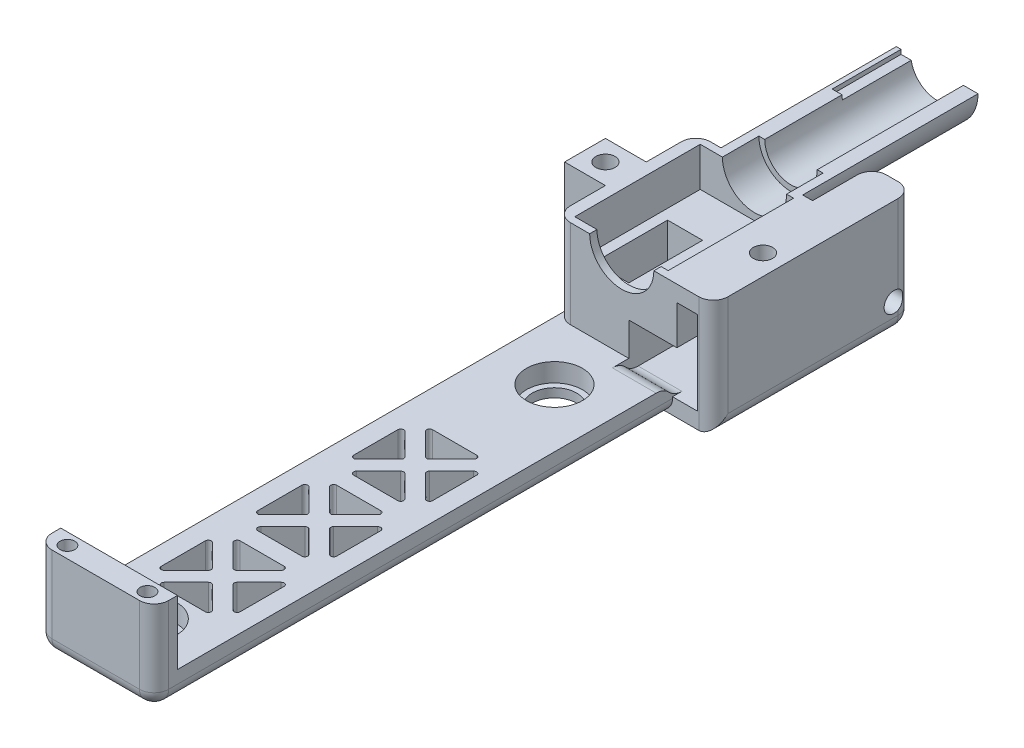
from build123d import *

# Parameters (mm, degrees)
SKETCH1_W                = 20
SKETCH1_H                = 112.840000126
BOSS_EXTRUDE1_DEPTH      = 4.68927065
SKETCH2_W                = 20
SKETCH2_H                = 4
BOSS_EXTRUDE2_DEPTH      = 10.99057492
SKETCH19_W               = 20
SKETCH19_H               = 24
BOSS_EXTRUDE6_DEPTH      = 15.15438009
SKETCH20_W               = 16
SKETCH20_H               = 21.5
CUT_EXTRUDE17_DEPTH      = 6.7
CUT_EXTRUDE18_REACH      = 117.007
SKETCH21_R               = 5.5
SKETCH22_W               = 7
SKETCH22_H               = 34.16
BOSS_EXTRUDE7_DEPTH      = 19.84365074
BOSS_EXTRUDE8_DEPTH      = 7
CUT_EXTRUDE19_REACH      = 73.726
SKETCH24_R               = 1.65
CUT_EXTRUDE2_DEPTH       = 73.262519007
CUT_EXTRUDE2_DEPTH_BACK  = 73.262519007
SKETCH5_W                = 6
SKETCH5_H                = 12.65
BOSS_EXTRUDE9_START      = 5
BOSS_EXTRUDE9_DEPTH      = 5
BOSS_EXTRUDE10_START     = 25.05
BOSS_EXTRUDE10_DEPTH     = 25.05
SKETCH27_W               = 1.75
SKETCH27_H               = 0.75
CUT_EXTRUDE20_DEPTH      = 11.8
SKETCH28_R               = 1.65
CUT_EXTRUDE21_DEPTH      = 93.248096983
M3_CLEARANCE_HOLE1_D     = 3.4
M3_CLEARANCE_HOLE1_DEPTH = 17.02
M3_CLEARANCE_HOLE1_TIP   = 1.021463052
SKETCH6_R                = 4.8006
CUT_EXTRUDE3_DEPTH       = 3.175
SKETCH7_R                = 3.81
CUT_EXTRUDE4_DEPTH       = 0.508
SKETCH8_R                = 4.8006
SKETCH8_R_2              = 3.302
CUT_EXTRUDE5_DEPTH       = 3.175
CUT_EXTRUDE6_REACH       = 93.934
SKETCH10_R               = 3.81
SHELL1_START             = 2.75
SHELL1_DEPTH             = 7.64365074
SHELL1_START_2           = 9.29365074
SHELL1_2_DEPTH           = 7.8
SHELL1_3_DEPTH           = 6.54365074
SHELL1_START_3           = 12.75
SHELL1_4_DEPTH           = 1.5
SKETCH13_R               = 1.2635
CUT_EXTRUDE11_DEPTH      = 10
CUT_EXTRUDE16_REACH      = 94.248
FILLET11_R               = 2.5
FILLET12_R               = 3
FILLET13_R               = 3


with BuildPart() as part:
    # Sketch1 → Boss-Extrude1 (new body)
    with BuildSketch(Plane(origin=(0, 0, 0), x_dir=(1, 0, 0), z_dir=(0, 1, 0))):
        with Locations((0, 2.000000063)):
            Rectangle(SKETCH1_W, SKETCH1_H)
    extrude(amount=BOSS_EXTRUDE1_DEPTH)

    # Sketch2 → Boss-Extrude2 (add)
    with BuildSketch(Plane(origin=(0, 4.68927065, 0), x_dir=(1, 0, 0), z_dir=(0, 1, 0))):
        with Locations((0, -52.42)):
            Rectangle(SKETCH2_W, SKETCH2_H)
    extrude(amount=BOSS_EXTRUDE2_DEPTH)

    # Sketch19 → Boss-Extrude6 (add)
    with BuildSketch(Plane(origin=(0, 4.68927065, 0), x_dir=(1, 0, 0), z_dir=(0, 1, 0))):
        with Locations((0, 46.420000126)):
            Rectangle(SKETCH19_W, SKETCH19_H)
    extrude(amount=BOSS_EXTRUDE6_DEPTH)

    # Sketch20 → Cut-Extrude17 (cut)
    with BuildSketch(Plane(origin=(0, 19.84365074, 0), x_dir=(1, 0, 0), z_dir=(0, 1, 0))):
        with Locations((0, 46.420000126)):
            Rectangle(SKETCH20_W, SKETCH20_H)
    extrude(amount=-CUT_EXTRUDE17_DEPTH, mode=Mode.SUBTRACT)

    # Cut-Extrude18: up to this face of the body (flat: up to its plane)
    cut_extrude18_end = Plane(part.part.faces().sort_by_distance((0, 12.266460695, -34.420000126))[0])
    # Sketch21 → Cut-Extrude18 (cut, up to the picked face)
    with BuildSketch(Plane(origin=(0, 0, -58.420000126), x_dir=(-1, 0, 0), z_dir=(0, 0, -1)), mode=Mode.PRIVATE) as cut_extrude18_sk1:
        with Locations((-1.3, 19.84365074)):
            Circle(SKETCH21_R)
    cut_extrude18_tool1 = split(extrude(cut_extrude18_sk1.sketch, amount=-CUT_EXTRUDE18_REACH, mode=Mode.PRIVATE), bisect_by=cut_extrude18_end, keep=Keep.BOTH, mode=Mode.PRIVATE)
    add(cut_extrude18_tool1.solids().sort_by(Axis((1.3, 19.843651, -58.42), (0, 0, 1)))[0], mode=Mode.SUBTRACT)

    # Sketch22 → Boss-Extrude7 (add)
    with BuildSketch(Plane(origin=(0, 19.84365074, 0), x_dir=(1, 0, 0), z_dir=(0, 1, 0))):
        with Locations((13.5, 51.500000126)):
            Rectangle(SKETCH22_W, SKETCH22_H)
    extrude(amount=-BOSS_EXTRUDE7_DEPTH)

    # Sketch23 → Boss-Extrude8 (add)
    with BuildSketch(Plane.ZY.offset(10)):
        Polygon((-42.920000126, 19.84365074), (-46.420000126, 19.84365074), (-49.920000126, 19.84365074), (-49.920000126, 12.34365074), (-42.920000126, 12.34365074), align=None)
    extrude(amount=BOSS_EXTRUDE8_DEPTH)

    # Sketch24 → Cut-Extrude19 (cut, up to next)
    with BuildSketch(Plane.XZ.offset(-12.34365074), mode=Mode.PRIVATE) as cut_extrude19_sk1:
        with Locations(Location((-13.5, -46.420000126, 0), (0, 0, 270))):
            Circle(SKETCH24_R)
    cut_extrude19_tool1 = extrude(cut_extrude19_sk1.sketch, amount=-CUT_EXTRUDE19_REACH, mode=Mode.PRIVATE) & part.part
    add(cut_extrude19_tool1.solids().sort_by_distance((-13.5, 12.343651, -46.42))[0], mode=Mode.SUBTRACT)

    # Sketch5 → Cut-Extrude2 (cut, two sides: drawn at the far end of the back side and taken through both)
    with BuildSketch(Plane(origin=(0, 4.68927065, 0), x_dir=(1, 0, 0), z_dir=(0, 1, 0)).offset(-CUT_EXTRUDE2_DEPTH_BACK)):
        with Locations((-3.25, 43.495000126)):
            Rectangle(SKETCH5_W, SKETCH5_H)
    extrude(amount=CUT_EXTRUDE2_DEPTH + CUT_EXTRUDE2_DEPTH_BACK, mode=Mode.SUBTRACT)

    # Sketch25 → Boss-Extrude9 (add)
    with BuildSketch(Plane(origin=(0, 0, -58.420000126), x_dir=(-1, 0, 0), z_dir=(0, 0, -1)).offset(BOSS_EXTRUDE9_START)):
        with BuildLine():
            Line((5.7, 19.84365074), (4.2, 19.84365074))
            ThreePointArc((4.2, 19.84365074), (-1.3, 14.34365074), (-6.8, 19.84365074))
            Line((-6.8, 19.84365074), (-8.3, 19.84365074))
            ThreePointArc((-8.3, 19.84365074), (-1.3, 12.84365074), (5.7, 19.84365074))
        make_face()
    extrude(amount=-BOSS_EXTRUDE9_DEPTH)

    # Sketch26 → Boss-Extrude10 (add)
    with BuildSketch(Plane(origin=(0, 0, -63.420000126), x_dir=(-1, 0, 0), z_dir=(0, 0, -1)).offset(BOSS_EXTRUDE10_START)):
        with BuildLine():
            Line((5.7, 19.84365074), (3.2, 19.84365074))
            ThreePointArc((3.2, 19.84365074), (-1.3, 15.34365074), (-5.8, 19.84365074))
            Line((-5.8, 19.84365074), (-8.3, 19.84365074))
            ThreePointArc((-8.3, 19.84365074), (-1.3, 12.84365074), (5.7, 19.84365074))
        make_face()
    extrude(amount=-BOSS_EXTRUDE10_DEPTH)

    # Sketch27 → Cut-Extrude20 (cut)
    with BuildSketch(Plane(origin=(0, 0, -88.470000126), x_dir=(-1, 0, 0), z_dir=(0, 0, -1))):
        with Locations((4.01205984, 19.46865074)):
            Rectangle(SKETCH27_W, SKETCH27_H)
    extrude(amount=-CUT_EXTRUDE20_DEPTH, mode=Mode.SUBTRACT)

    # Sketch28 → Cut-Extrude21 (cut, through all)
    with BuildSketch(Plane(origin=(0, 19.84365074, 0), x_dir=(1, 0, 0), z_dir=(0, 1, 0))):
        with Locations(Location((13.5, 46.420000126, 0), (0, 0, 270))):
            Circle(SKETCH28_R)
    extrude(amount=-CUT_EXTRUDE21_DEPTH, mode=Mode.SUBTRACT)

    # M3 Clearance Hole1
    with Locations(Plane(origin=(17, 0, 0), x_dir=(0, 0, -1), z_dir=(1, 0, 0))):
        with Locations((65.380000126, 4.84365074)):
            Hole(M3_CLEARANCE_HOLE1_D / 2, depth=M3_CLEARANCE_HOLE1_DEPTH)
            with Locations((0, 0, -(M3_CLEARANCE_HOLE1_DEPTH + M3_CLEARANCE_HOLE1_TIP / 2))):  # 118° drill point
                Cone(0, M3_CLEARANCE_HOLE1_D / 2, M3_CLEARANCE_HOLE1_TIP, mode=Mode.SUBTRACT)

    # Sketch6 → Cut-Extrude3 (cut)
    with BuildSketch(Plane(origin=(0, 4.68927065, 0), x_dir=(1, 0, 0), z_dir=(0, 1, 0))):
        with Locations(Location((0, -45.34, 0), (0, 0, 270))):
            Circle(SKETCH6_R)
    extrude(amount=-CUT_EXTRUDE3_DEPTH, mode=Mode.SUBTRACT)

    # Sketch7 → Cut-Extrude4 (cut)
    with BuildSketch(Plane(origin=(0, 1.51427065, 0), x_dir=(1, 0, 0), z_dir=(0, 1, 0))):
        with Locations(Location((0, -45.34, 0), (0, 0, 270))):
            Circle(SKETCH7_R)
    extrude(amount=-CUT_EXTRUDE4_DEPTH, mode=Mode.SUBTRACT)

    # Sketch8 → Cut-Extrude5 (cut)
    with BuildSketch(Plane(origin=(0, 4.68927065, 0), x_dir=(1, 0, 0), z_dir=(0, 1, 0))):
        with Locations(Location((0, 24.18399989, 0), (0, 0, 270))):
            Circle(SKETCH8_R)
        with Locations((0, -45.34)):
            Circle(SKETCH8_R_2)
    extrude(amount=-CUT_EXTRUDE5_DEPTH, mode=Mode.SUBTRACT)

    # Sketch10 → Cut-Extrude6 (cut, up to next)
    with BuildSketch(Plane(origin=(0, 1.51427065, 0), x_dir=(1, 0, 0), z_dir=(0, 1, 0)), mode=Mode.PRIVATE) as cut_extrude6_sk1:
        with Locations(Location((0, 24.18399989, 0), (0, 0, 270))):
            Circle(SKETCH10_R)
    cut_extrude6_tool1 = extrude(cut_extrude6_sk1.sketch, amount=-CUT_EXTRUDE6_REACH, mode=Mode.PRIVATE) & part.part
    add(cut_extrude6_tool1.solids().sort_by_distance((0, 1.514271, -24.184))[0], mode=Mode.SUBTRACT)

    # Shell1: read off the stored shape, not the designer's step
    # Shell1 outline → Shell1 (cut)
    with BuildSketch(Plane(origin=(0, 0, 0), x_dir=(1, 0, 0), z_dir=(0, 1, 0)).offset(SHELL1_START)):
        with BuildLine():
            Line((2.5, 34.420000126), (14.25, 34.420000126))
            Line((14.25, 34.420000126), (14.25, 42.084391749))
            ThreePointArc((14.25, 42.084391749), (9.488190801, 44.612961955), (10.75, 49.854749025))
            Line((10.75, 49.854749025), (10.75, 55.670000126))
            Line((10.75, 55.670000126), (-7.25, 55.670000126))
            Line((-7.25, 55.670000126), (-7.25, 52.570000126))
            Line((-7.25, 52.570000126), (2.5, 52.570000126))
            Line((2.5, 52.570000126), (2.5, 34.420000126))
        make_face()
    extrude(amount=SHELL1_DEPTH, mode=Mode.SUBTRACT)

    # Shell1 2 outline → Shell1 2 (cut)
    with BuildSketch(Plane(origin=(0, 0, 0), x_dir=(1, 0, 0), z_dir=(0, 1, 0)).offset(SHELL1_START_2)):
        with BuildLine():
            Line((10.75, 42.985251227), (10.75, 34.420000126))
            Line((10.75, 34.420000126), (14.25, 34.420000126))
            Line((14.25, 34.420000126), (14.25, 42.084391749))
            ThreePointArc((14.25, 42.084391749), (12.40323797, 42.158883717), (10.75, 42.985251227))
        make_face()
        with BuildLine():
            Line((10.75, 55.670000126), (10.75, 49.854749025))
            ThreePointArc((10.75, 49.854749025), (12.40323797, 50.681116535), (14.25, 50.755608503))
            Line((14.25, 50.755608503), (14.25, 65.830000126))
            Line((14.25, 65.830000126), (12.75, 65.830000126))
            Line((12.75, 65.830000126), (12.75, 55.670000126))
            Line((12.75, 55.670000126), (10.75, 55.670000126))
        make_face()
    extrude(amount=SHELL1_2_DEPTH, mode=Mode.SUBTRACT)

    # Shell1 3 outline → Shell1 3 (cut)
    with BuildSketch(Plane(origin=(0, 0, 0), x_dir=(1, 0, 0), z_dir=(0, 1, 0)).offset(SHELL1_START)):
        with BuildLine():
            ThreePointArc((10.75, 49.854749025), (12.40323797, 50.681116535), (14.25, 50.755608503))
            Line((14.25, 50.755608503), (14.25, 65.830000126))
            Line((14.25, 65.830000126), (12.75, 65.830000126))
            Line((12.75, 65.830000126), (12.75, 55.670000126))
            Line((12.75, 55.670000126), (10.75, 55.670000126))
            Line((10.75, 55.670000126), (10.75, 49.854749025))
        make_face()
    extrude(amount=SHELL1_3_DEPTH, mode=Mode.SUBTRACT)

    # Shell1 4 outline → Shell1 4 (add)
    with BuildSketch(Plane.YZ.offset(SHELL1_START_3)):
        with BuildLine():
            ThreePointArc((3.204291109, -65.830000126), (4.84365074, -63.680000126), (6.483010371, -65.830000126))
            Line((6.483010371, -65.830000126), (9.270839464, -65.830000126))
            ThreePointArc((9.270839464, -65.830000126), (7.323624213, -61.685107493), (2.75, -61.453280556))
            Line((2.75, -61.453280556), (2.75, -65.830000126))
            Line((2.75, -65.830000126), (3.204291109, -65.830000126))
        make_face()
    extrude(amount=SHELL1_4_DEPTH)

    # Sketch13 → Cut-Extrude11 (cut)
    with BuildSketch(Plane(origin=(0, 15.67984557, 0), x_dir=(1, 0, 0), z_dir=(0, 1, 0))):
        with Locations(Location((-6.858, -52.42, 0), (0, 0, 270))):
            Circle(SKETCH13_R)
        with Locations(Location((6.858, -52.42, 0), (0, 0, 270))):
            Circle(SKETCH13_R)
    extrude(amount=-CUT_EXTRUDE11_DEPTH, mode=Mode.SUBTRACT)

    # Sketch18 → Cut-Extrude16 (cut, up to next)
    with BuildSketch(Plane(origin=(0, 0, 0), x_dir=(-1, 0, 0), z_dir=(0, -1, 0)), mode=Mode.PRIVATE) as cut_extrude16_sk1:
        with BuildLine():
            Line((2.073075498, -0.084547272), (5.846655008, -3.858126783))
            ThreePointArc((5.846655008, -3.858126783), (6.400268437, -3.96824734), (6.713865253, -3.498916538))
            Line((6.713865253, -3.498916538), (6.713865253, 4.048242483))
            ThreePointArc((6.713865253, 4.048242483), (6.400268437, 4.517573285), (5.846655008, 4.407452728))
            Line((5.846655008, 4.407452728), (2.073075498, 0.633873217))
            ThreePointArc((2.073075498, 0.633873217), (1.924285743, 0.274662973), (2.073075498, -0.084547272))
        make_face()
    cut_extrude16_tool1 = extrude(cut_extrude16_sk1.sketch, amount=-CUT_EXTRUDE16_REACH, mode=Mode.PRIVATE) & part.part
    # Sketch18 → Cut-Extrude16 (cut, up to next)
    with BuildSketch(Plane(origin=(0, 0, 0), x_dir=(-1, 0, 0), z_dir=(0, -1, 0)), mode=Mode.PRIVATE) as cut_extrude16_sk2:
        with BuildLine():
            Line((0.3154759, 2.391472815), (4.08905541, 6.165052326))
            ThreePointArc((4.08905541, 6.165052326), (4.199175968, 6.718665754), (3.729845166, 7.032262571))
            Line((3.729845166, 7.032262571), (-3.817313855, 7.032262571))
            ThreePointArc((-3.817313855, 7.032262571), (-4.286644658, 6.718665754), (-4.1765241, 6.165052326))
            Line((-4.1765241, 6.165052326), (-0.40294459, 2.391472815))
            ThreePointArc((-0.40294459, 2.391472815), (-0.043734345, 2.24268306), (0.3154759, 2.391472815))
        make_face()
    cut_extrude16_tool2 = extrude(cut_extrude16_sk2.sketch, amount=-CUT_EXTRUDE16_REACH, mode=Mode.PRIVATE) & part.part
    # Sketch18 → Cut-Extrude16 (cut, up to next)
    with BuildSketch(Plane(origin=(0, 0, 0), x_dir=(-1, 0, 0), z_dir=(0, -1, 0)), mode=Mode.PRIVATE) as cut_extrude16_sk3:
        with BuildLine():
            Line((-0.40294459, -1.84214687), (-4.1765241, -5.615726381))
            ThreePointArc((-4.1765241, -5.615726381), (-4.286644658, -6.169339809), (-3.817313855, -6.482936625))
            Line((-3.817313855, -6.482936625), (3.729845166, -6.482936625))
            ThreePointArc((3.729845166, -6.482936625), (4.199175968, -6.169339809), (4.08905541, -5.615726381))
            Line((4.08905541, -5.615726381), (0.3154759, -1.84214687))
            ThreePointArc((0.3154759, -1.84214687), (-0.043734345, -1.693357115), (-0.40294459, -1.84214687))
        make_face()
    cut_extrude16_tool3 = extrude(cut_extrude16_sk3.sketch, amount=-CUT_EXTRUDE16_REACH, mode=Mode.PRIVATE) & part.part
    # Sketch18 → Cut-Extrude16 (cut, up to next)
    with BuildSketch(Plane(origin=(0, 0, 0), x_dir=(-1, 0, 0), z_dir=(0, -1, 0)), mode=Mode.PRIVATE) as cut_extrude16_sk4:
        with BuildLine():
            Line((-2.160544188, 0.633873217), (-5.934123698, 4.407452728))
            ThreePointArc((-5.934123698, 4.407452728), (-6.487737126, 4.517573285), (-6.801333943, 4.048242483))
            Line((-6.801333943, 4.048242483), (-6.801333943, -3.498916538))
            ThreePointArc((-6.801333943, -3.498916538), (-6.487737126, -3.96824734), (-5.934123698, -3.858126783))
            Line((-5.934123698, -3.858126783), (-2.160544188, -0.084547272))
            ThreePointArc((-2.160544188, -0.084547272), (-2.011754432, 0.274662973), (-2.160544188, 0.633873217))
        make_face()
    cut_extrude16_tool4 = extrude(cut_extrude16_sk4.sketch, amount=-CUT_EXTRUDE16_REACH, mode=Mode.PRIVATE) & part.part
    # Sketch18 → Cut-Extrude16 (cut, up to next)
    with BuildSketch(Plane(origin=(0, 0, 0), x_dir=(-1, 0, 0), z_dir=(0, -1, 0)), mode=Mode.PRIVATE) as cut_extrude16_sk5:
        with BuildLine():
            Line((2.055146486, -16.542228087), (5.828725996, -20.315807597))
            ThreePointArc((5.828725996, -20.315807597), (6.382339424, -20.425928155), (6.695936241, -19.956597353))
            Line((6.695936241, -19.956597353), (6.695936241, -12.409438332))
            ThreePointArc((6.695936241, -12.409438332), (6.382339424, -11.940107529), (5.828725996, -12.050228087))
            Line((5.828725996, -12.050228087), (2.055146486, -15.823807597))
            ThreePointArc((2.055146486, -15.823807597), (1.90635673, -16.183017842), (2.055146486, -16.542228087))
        make_face()
    cut_extrude16_tool5 = extrude(cut_extrude16_sk5.sketch, amount=-CUT_EXTRUDE16_REACH, mode=Mode.PRIVATE) & part.part
    # Sketch18 → Cut-Extrude16 (cut, up to next)
    with BuildSketch(Plane(origin=(0, 0, 0), x_dir=(-1, 0, 0), z_dir=(0, -1, 0)), mode=Mode.PRIVATE) as cut_extrude16_sk6:
        with BuildLine():
            Line((0.297546888, -14.066207999), (4.071126398, -10.292628489))
            ThreePointArc((4.071126398, -10.292628489), (4.181246956, -9.739015061), (3.711916153, -9.425418244))
            Line((3.711916153, -9.425418244), (-3.835242868, -9.425418244))
            ThreePointArc((-3.835242868, -9.425418244), (-4.30457367, -9.739015061), (-4.194453112, -10.292628489))
            Line((-4.194453112, -10.292628489), (-0.420873602, -14.066207999))
            ThreePointArc((-0.420873602, -14.066207999), (-0.061663357, -14.214997755), (0.297546888, -14.066207999))
        make_face()
    cut_extrude16_tool6 = extrude(cut_extrude16_sk6.sketch, amount=-CUT_EXTRUDE16_REACH, mode=Mode.PRIVATE) & part.part
    # Sketch18 → Cut-Extrude16 (cut, up to next)
    with BuildSketch(Plane(origin=(0, 0, 0), x_dir=(-1, 0, 0), z_dir=(0, -1, 0)), mode=Mode.PRIVATE) as cut_extrude16_sk7:
        with BuildLine():
            Line((-0.420873602, -18.299827685), (-4.194453112, -22.073407195))
            ThreePointArc((-4.194453112, -22.073407195), (-4.30457367, -22.627020624), (-3.835242868, -22.94061744))
            Line((-3.835242868, -22.94061744), (3.711916153, -22.94061744))
            ThreePointArc((3.711916153, -22.94061744), (4.181246956, -22.627020624), (4.071126398, -22.073407195))
            Line((4.071126398, -22.073407195), (0.297546888, -18.299827685))
            ThreePointArc((0.297546888, -18.299827685), (-0.061663357, -18.15103793), (-0.420873602, -18.299827685))
        make_face()
    cut_extrude16_tool7 = extrude(cut_extrude16_sk7.sketch, amount=-CUT_EXTRUDE16_REACH, mode=Mode.PRIVATE) & part.part
    # Sketch18 → Cut-Extrude16 (cut, up to next)
    with BuildSketch(Plane(origin=(0, 0, 0), x_dir=(-1, 0, 0), z_dir=(0, -1, 0)), mode=Mode.PRIVATE) as cut_extrude16_sk8:
        with BuildLine():
            Line((-2.1784732, -15.823807597), (-5.95205271, -12.050228087))
            ThreePointArc((-5.95205271, -12.050228087), (-6.505666139, -11.940107529), (-6.819262955, -12.409438332))
            Line((-6.819262955, -12.409438332), (-6.819262955, -19.956597353))
            ThreePointArc((-6.819262955, -19.956597353), (-6.505666139, -20.425928155), (-5.95205271, -20.315807597))
            Line((-5.95205271, -20.315807597), (-2.1784732, -16.542228087))
            ThreePointArc((-2.1784732, -16.542228087), (-2.029683445, -16.183017842), (-2.1784732, -15.823807597))
        make_face()
    cut_extrude16_tool8 = extrude(cut_extrude16_sk8.sketch, amount=-CUT_EXTRUDE16_REACH, mode=Mode.PRIVATE) & part.part
    # Sketch18 → Cut-Extrude16 (cut, up to next)
    with BuildSketch(Plane(origin=(0, 0, 0), x_dir=(-1, 0, 0), z_dir=(0, -1, 0)), mode=Mode.PRIVATE) as cut_extrude16_sk9:
        with BuildLine():
            Line((2.070039222, -33.073628806), (5.843618732, -36.847208316))
            ThreePointArc((5.843618732, -36.847208316), (6.397232161, -36.957328874), (6.710828977, -36.487998071))
            Line((6.710828977, -36.487998071), (6.710828977, -28.94083905))
            ThreePointArc((6.710828977, -28.94083905), (6.397232161, -28.471508248), (5.843618732, -28.581628806))
            Line((5.843618732, -28.581628806), (2.070039222, -32.355208316))
            ThreePointArc((2.070039222, -32.355208316), (1.921249467, -32.714418561), (2.070039222, -33.073628806))
        make_face()
    cut_extrude16_tool9 = extrude(cut_extrude16_sk9.sketch, amount=-CUT_EXTRUDE16_REACH, mode=Mode.PRIVATE) & part.part
    # Sketch18 → Cut-Extrude16 (cut, up to next)
    with BuildSketch(Plane(origin=(0, 0, 0), x_dir=(-1, 0, 0), z_dir=(0, -1, 0)), mode=Mode.PRIVATE) as cut_extrude16_sk10:
        with BuildLine():
            Line((0.312439624, -30.597608718), (4.086019134, -26.824029208))
            ThreePointArc((4.086019134, -26.824029208), (4.196139692, -26.270415779), (3.726808889, -25.956818963))
            Line((3.726808889, -25.956818963), (-3.820350131, -25.956818963))
            ThreePointArc((-3.820350131, -25.956818963), (-4.289680934, -26.270415779), (-4.179560376, -26.824029208))
            Line((-4.179560376, -26.824029208), (-0.405980866, -30.597608718))
            ThreePointArc((-0.405980866, -30.597608718), (-0.046770621, -30.746398473), (0.312439624, -30.597608718))
        make_face()
    cut_extrude16_tool10 = extrude(cut_extrude16_sk10.sketch, amount=-CUT_EXTRUDE16_REACH, mode=Mode.PRIVATE) & part.part
    # Sketch18 → Cut-Extrude16 (cut, up to next)
    with BuildSketch(Plane(origin=(0, 0, 0), x_dir=(-1, 0, 0), z_dir=(0, -1, 0)), mode=Mode.PRIVATE) as cut_extrude16_sk11:
        with BuildLine():
            Line((-0.405980866, -34.831228404), (-4.179560376, -38.604807914))
            ThreePointArc((-4.179560376, -38.604807914), (-4.289680934, -39.158421342), (-3.820350131, -39.472018159))
            Line((-3.820350131, -39.472018159), (3.726808889, -39.472018159))
            ThreePointArc((3.726808889, -39.472018159), (4.196139692, -39.158421342), (4.086019134, -38.604807914))
            Line((4.086019134, -38.604807914), (0.312439624, -34.831228404))
            ThreePointArc((0.312439624, -34.831228404), (-0.046770621, -34.682438648), (-0.405980866, -34.831228404))
        make_face()
    cut_extrude16_tool11 = extrude(cut_extrude16_sk11.sketch, amount=-CUT_EXTRUDE16_REACH, mode=Mode.PRIVATE) & part.part
    # Sketch18 → Cut-Extrude16 (cut, up to next)
    with BuildSketch(Plane(origin=(0, 0, 0), x_dir=(-1, 0, 0), z_dir=(0, -1, 0)), mode=Mode.PRIVATE) as cut_extrude16_sk12:
        with BuildLine():
            Line((-2.163580464, -32.355208316), (-5.937159974, -28.581628806))
            ThreePointArc((-5.937159974, -28.581628806), (-6.490773403, -28.471508248), (-6.804370219, -28.94083905))
            Line((-6.804370219, -28.94083905), (-6.804370219, -36.487998071))
            ThreePointArc((-6.804370219, -36.487998071), (-6.490773403, -36.957328874), (-5.937159974, -36.847208316))
            Line((-5.937159974, -36.847208316), (-2.163580464, -33.073628806))
            ThreePointArc((-2.163580464, -33.073628806), (-2.014790709, -32.714418561), (-2.163580464, -32.355208316))
        make_face()
    cut_extrude16_tool12 = extrude(cut_extrude16_sk12.sketch, amount=-CUT_EXTRUDE16_REACH, mode=Mode.PRIVATE) & part.part
    add(cut_extrude16_tool1.solids().sort_by_distance((-5.016606, 0, -0.274663))[0], mode=Mode.SUBTRACT)
    add(cut_extrude16_tool2.solids().sort_by_distance((0.043734, 0, -5.335003))[0], mode=Mode.SUBTRACT)
    add(cut_extrude16_tool3.solids().sort_by_distance((0.043734, 0, 4.785677))[0], mode=Mode.SUBTRACT)
    add(cut_extrude16_tool4.solids().sort_by_distance((5.104075, 0, -0.274663))[0], mode=Mode.SUBTRACT)
    add(cut_extrude16_tool5.solids().sort_by_distance((-4.998677, 0, 16.183018))[0], mode=Mode.SUBTRACT)
    add(cut_extrude16_tool6.solids().sort_by_distance((0.061663, 0, 11.122678))[0], mode=Mode.SUBTRACT)
    add(cut_extrude16_tool7.solids().sort_by_distance((0.061663, 0, 21.243358))[0], mode=Mode.SUBTRACT)
    add(cut_extrude16_tool8.solids().sort_by_distance((5.122004, 0, 16.183018))[0], mode=Mode.SUBTRACT)
    add(cut_extrude16_tool9.solids().sort_by_distance((-5.01357, 0, 32.714419))[0], mode=Mode.SUBTRACT)
    add(cut_extrude16_tool10.solids().sort_by_distance((0.046771, 0, 27.654078))[0], mode=Mode.SUBTRACT)
    add(cut_extrude16_tool11.solids().sort_by_distance((0.046771, 0, 37.774759))[0], mode=Mode.SUBTRACT)
    add(cut_extrude16_tool12.solids().sort_by_distance((5.107111, 0, 32.714419))[0], mode=Mode.SUBTRACT)

    # Fillet11
    # the kernel refuses this fillet: 2.5 mm, written as the material it takes off along each edge
    with BuildSketch(Plane(origin=(-7.5, 2.5, 51.92), x_dir=(-1, 0, 0), z_dir=(0, 0, 1))) as fillet11_piece_1_section:
        Polygon((0, 0), (FILLET11_R * 1.02, 0), (FILLET11_R * 1.02, FILLET11_R * 1.02), (0, FILLET11_R * 1.02), align=None)
    fillet11_piece_1 = extrude(amount=FILLET11_R * 1.02, mode=Mode.PRIVATE)
    fillet11_piece_1 = fillet11_piece_1 - Plane(origin=(-7.5, 2.5, 51.92), x_dir=(0.7071067811865475, 0.7071067811865475, 0), z_dir=(0, 0, 1)) * Sphere(FILLET11_R, mode=Mode.PRIVATE)
    add(fillet11_piece_1, mode=Mode.SUBTRACT)
    with BuildSketch(Plane(origin=(7.5, 2.5, 51.92), x_dir=(1, 0, 0), z_dir=(0, 0, 1))) as fillet11_piece_2_section:
        Polygon((0, 0), (FILLET11_R * 1.02, 0), (FILLET11_R * 1.02, -FILLET11_R * 1.02), (0, -FILLET11_R * 1.02), align=None)
    fillet11_piece_2 = extrude(amount=FILLET11_R * 1.02, mode=Mode.PRIVATE)
    fillet11_piece_2 = fillet11_piece_2 - Plane(origin=(7.5, 2.5, 51.92), x_dir=(-0.7071067811865475, 0.7071067811865475, 0), z_dir=(0, 0, 1)) * Sphere(FILLET11_R, mode=Mode.PRIVATE)
    add(fillet11_piece_2, mode=Mode.SUBTRACT)
    with BuildSketch(Plane(origin=(12.5, 2.5, -66.080000126), x_dir=(0, 0, -1), z_dir=(-1, 0, 0))) as fillet11_piece_3_section:
        Polygon((0, 0), (FILLET11_R * 1.02, 0), (FILLET11_R * 1.02, FILLET11_R * 1.02), (0, FILLET11_R * 1.02), align=None)
    fillet11_piece_3 = extrude(amount=FILLET11_R * 1.02, mode=Mode.PRIVATE)
    fillet11_piece_3 = fillet11_piece_3 - Plane(origin=(12.5, 2.5, -66.080000126), x_dir=(0, 0.7071067811865475, 0.7071067811865475), z_dir=(-1, 0, 0)) * Sphere(FILLET11_R, mode=Mode.PRIVATE)
    add(fillet11_piece_3, mode=Mode.SUBTRACT)
    with BuildSketch(Plane(origin=(14.5, 2.5, -66.080000126), x_dir=(0, 0, -1), z_dir=(1, 0, 0))) as fillet11_piece_4_section:
        Polygon((0, 0), (FILLET11_R * 1.02, 0), (FILLET11_R * 1.02, -FILLET11_R * 1.02), (0, -FILLET11_R * 1.02), align=None)
    fillet11_piece_4 = extrude(amount=FILLET11_R * 1.02, mode=Mode.PRIVATE)
    fillet11_piece_4 = fillet11_piece_4 - Plane(origin=(14.5, 2.5, -66.080000126), x_dir=(0, 0.7071067811865475, 0.7071067811865475), z_dir=(1, 0, 0)) * Sphere(FILLET11_R, mode=Mode.PRIVATE)
    add(fillet11_piece_4, mode=Mode.SUBTRACT)
    with BuildSketch(Plane(origin=(-7.5, 2.5, -55.920000126), x_dir=(0, -1, 0), z_dir=(-1, 0, 0))) as fillet11_piece_5_section:
        Polygon((0, 0), (FILLET11_R * 1.02, 0), (FILLET11_R * 1.02, -FILLET11_R * 1.02), (0, -FILLET11_R * 1.02), align=None)
    fillet11_piece_5 = extrude(amount=FILLET11_R * 1.02, mode=Mode.PRIVATE)
    fillet11_piece_5 = fillet11_piece_5 - Plane(origin=(-7.5, 2.5, -55.920000126), x_dir=(0, 0.7071067811865475, 0.7071067811865475), z_dir=(-1, 0, 0)) * Sphere(FILLET11_R, mode=Mode.PRIVATE)
    add(fillet11_piece_5, mode=Mode.SUBTRACT)
    with BuildSketch(Plane(origin=(-7.5, 0, 54.42), x_dir=(0, 1, 0), z_dir=(1, 0, 0))) as fillet11_piece_6:
        with BuildLine():
            CenterArc((FILLET11_R, -FILLET11_R), FILLET11_R, 90, 90)
            Line((0, -FILLET11_R), (0, 0))
            Line((0, 0), (FILLET11_R, 0))
        make_face()
    extrude(amount=15, mode=Mode.SUBTRACT)
    with BuildSketch(Plane(origin=(10, 2.5, 54.42), x_dir=(-1, 0, 0), z_dir=(0, 1, 0)), Plane(origin=(-10, 21.92984557, 54.42), x_dir=(1, 0, 0), z_dir=(0, -1, 0))) as fillet11_piece_7:
        with BuildLine():
            CenterArc((FILLET11_R, -FILLET11_R), FILLET11_R, 90, 90)
            Line((0, -FILLET11_R), (0, 0))
            Line((0, 0), (FILLET11_R, 0))
        make_face()
    extrude(amount=19.42984557, mode=Mode.SUBTRACT)
    with BuildSketch(Plane(origin=(-10, 4.68927065, -34.420000126), x_dir=(0, 0, -1), z_dir=(0, 1, 0))) as fillet11_piece_8:
        with BuildLine():
            CenterArc((FILLET11_R, -FILLET11_R), FILLET11_R, 90, 90)
            Line((0, -FILLET11_R), (0, 0))
            Line((0, 0), (FILLET11_R, 0))
        make_face()
    extrude(amount=21.40438009, mode=Mode.SUBTRACT)
    with BuildSketch(Plane(origin=(10, 26.09365074, -68.580000126), x_dir=(0, 0, 1), z_dir=(0, -1, 0)), Plane(origin=(-10, 26.09365074, -58.420000126), x_dir=(0, 0, 1), z_dir=(0, -1, 0))) as fillet11_piece_9:
        with BuildLine():
            CenterArc((FILLET11_R, -FILLET11_R), FILLET11_R, 90, 90)
            Line((0, -FILLET11_R), (0, 0))
            Line((0, 0), (FILLET11_R, 0))
        make_face()
    extrude(amount=23.59365074, mode=Mode.SUBTRACT)
    with BuildSketch(Plane(origin=(17, 26.09365074, -68.580000126), x_dir=(0, 0, 1), z_dir=(0, -1, 0))) as fillet11_piece_10:
        with BuildLine():
            CenterArc((FILLET11_R, FILLET11_R), FILLET11_R, 180, 90)
            Line((0, FILLET11_R), (0, 0))
            Line((0, 0), (FILLET11_R, 0))
        make_face()
    extrude(amount=23.59365074, mode=Mode.SUBTRACT)
    with BuildSketch(Plane(origin=(17, 26.09365074, -34.420000126), x_dir=(-1, 0, 0), z_dir=(0, -1, 0))) as fillet11_piece_11:
        with BuildLine():
            CenterArc((FILLET11_R, FILLET11_R), FILLET11_R, 180, 90)
            Line((0, FILLET11_R), (0, 0))
            Line((0, 0), (FILLET11_R, 0))
        make_face()
    extrude(amount=32.34365074, mode=Mode.SUBTRACT)
    with BuildSketch(Plane(origin=(17, 0, -28.170000126), x_dir=(-1, 0, 0), z_dir=(0, 0, -1))) as fillet11_piece_12:
        with BuildLine():
            CenterArc((FILLET11_R, FILLET11_R), FILLET11_R, 180, 90)
            Line((0, FILLET11_R), (0, 0))
            Line((0, 0), (FILLET11_R, 0))
        make_face()
    extrude(amount=37.91, mode=Mode.SUBTRACT)
    with BuildSketch(Plane(origin=(14.5, 0, -68.580000126), x_dir=(0, 0, 1), z_dir=(-1, 0, 0))) as fillet11_piece_13:
        with BuildLine():
            CenterArc((FILLET11_R, FILLET11_R), FILLET11_R, 180, 90)
            Line((0, FILLET11_R), (0, 0))
            Line((0, 0), (FILLET11_R, 0))
        make_face()
    extrude(amount=2, mode=Mode.SUBTRACT)
    with BuildSketch(Plane(origin=(10, 0, -66.080000126), x_dir=(1, 0, 0), z_dir=(0, 0, 1))) as fillet11_piece_14:
        with BuildLine():
            CenterArc((FILLET11_R, FILLET11_R), FILLET11_R, 180, 90)
            Line((0, FILLET11_R), (0, 0))
            Line((0, 0), (FILLET11_R, 0))
        make_face()
    extrude(amount=7.66, mode=Mode.SUBTRACT)
    with BuildSketch(Plane(origin=(10, 0, -58.420000126), x_dir=(0, 0, 1), z_dir=(-1, 0, 0))) as fillet11_piece_15:
        with BuildLine():
            CenterArc((FILLET11_R, FILLET11_R), FILLET11_R, 180, 90)
            Line((0, FILLET11_R), (0, 0))
            Line((0, 0), (FILLET11_R, 0))
        make_face()
    extrude(amount=17.5, mode=Mode.SUBTRACT)
    with BuildSketch(Plane(origin=(-10, 0, -55.920000126), x_dir=(0, 1, 0), z_dir=(0, 0, 1))) as fillet11_piece_16:
        with BuildLine():
            CenterArc((FILLET11_R, -FILLET11_R), FILLET11_R, 90, 90)
            Line((0, -FILLET11_R), (0, 0))
            Line((0, 0), (FILLET11_R, 0))
        make_face()
    extrude(amount=107.840000126, mode=Mode.SUBTRACT)
    with BuildSketch(Plane(origin=(10, 0, 51.92), x_dir=(0, 1, 0), z_dir=(0, 0, -1))) as fillet11_piece_17:
        with BuildLine():
            CenterArc((FILLET11_R, -FILLET11_R), FILLET11_R, 90, 90)
            Line((0, -FILLET11_R), (0, 0))
            Line((0, 0), (FILLET11_R, 0))
        make_face()
    extrude(amount=86.340000126, mode=Mode.SUBTRACT)
    with BuildSketch(Plane(origin=(16.25, 0, -58.420000126), x_dir=(0, 0, 1), z_dir=(-1, 0, 0))) as fillet11_piece_18a_section:
        with BuildLine():
            CenterArc((FILLET11_R, FILLET11_R), FILLET11_R, 180, 90)
            Line((0, FILLET11_R), (0, 0))
            Line((0, 0), (FILLET11_R, 0))
        make_face()
    fillet11_piece_18a = extrude(amount=23.75, mode=Mode.PRIVATE)
    fillet11_piece_18a = split(fillet11_piece_18a, bisect_by=Plane(origin=(10, 0, -58.420000126), z_dir=(1, 0, 0)), keep=Keep.TOP, mode=Mode.PRIVATE)
    with BuildSketch(Plane(origin=(10, 0, -66.080000126), x_dir=(1, 0, 0), z_dir=(0, 0, 1))) as fillet11_piece_18b_section:
        with BuildLine():
            CenterArc((FILLET11_R, FILLET11_R), FILLET11_R, 180, 90)
            Line((0, FILLET11_R), (0, 0))
            Line((0, 0), (FILLET11_R, 0))
        make_face()
    fillet11_piece_18b = extrude(amount=13.91, mode=Mode.PRIVATE)
    fillet11_piece_18b = split(fillet11_piece_18b, bisect_by=Plane(origin=(10, 0, -58.420000126), z_dir=(0, 0, 1)), keep=Keep.TOP, mode=Mode.PRIVATE)
    fillet11_piece_18 = fillet11_piece_18a & fillet11_piece_18b
    add(fillet11_piece_18, mode=Mode.SUBTRACT)

    # Fillet12
    # the kernel refuses this fillet: 3 mm, written as the material it takes off along each edge
    with BuildSketch(Plane(origin=(17.01554223, 4.68927065, -34.420000126), x_dir=(0, 0, 1), z_dir=(-1, 0, 0))) as fillet12_piece_1:
        with BuildLine():
            CenterArc((2.806216892, -3), FILLET12_R, 90, 69.293776509)
            Line((0, -1.93927065), (0, 0))
            Line((0, 0), (2.806216892, 0))
        make_face()
    extrude(amount=14.51554223, mode=Mode.SUBTRACT)

    # Fillet13
    fillet13_edges = [part.edges().sort_by_distance(p)[0] for p in [
        (6.25, 2.75, -34.420000126),
    ]]
    fillet(fillet13_edges, radius=FILLET13_R)


solid = part.part
